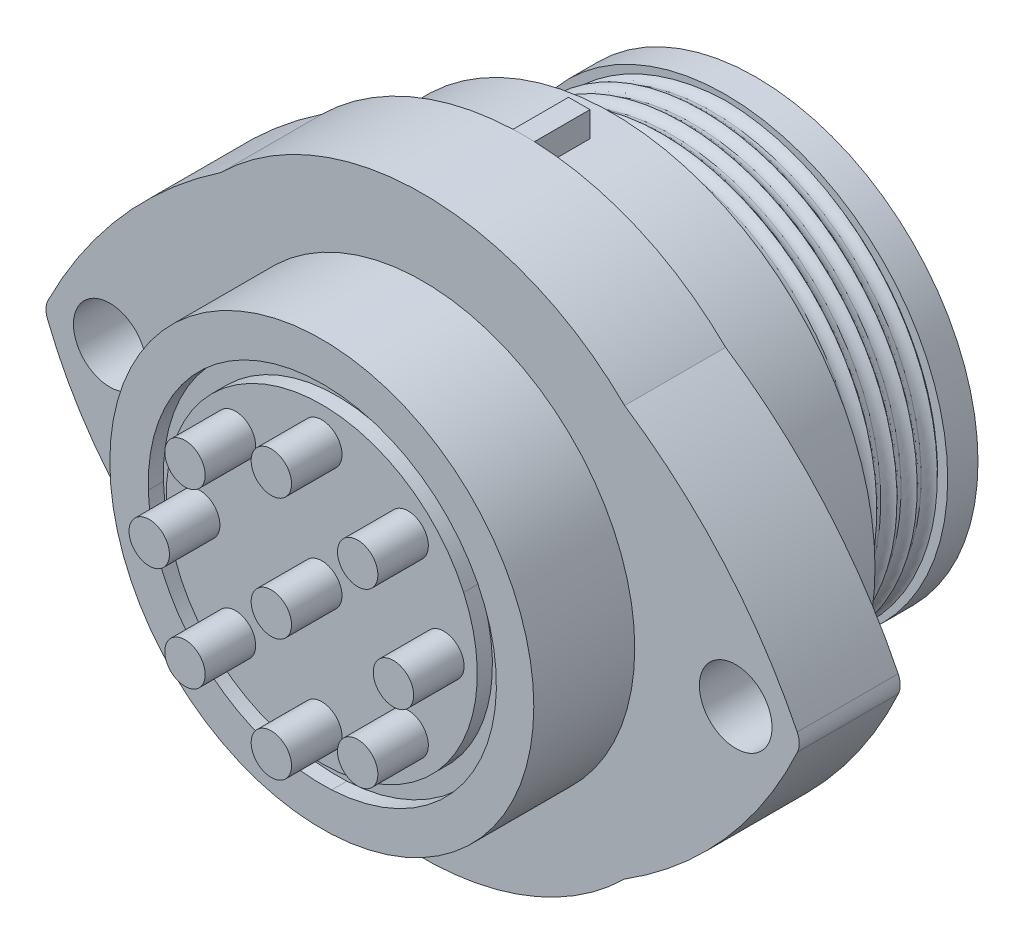
from build123d import *

# Parameters (mm, degrees)
SKETCH1_R            = 10.5
BOSS_EXTRUDE1_DEPTH  = 5
BOSS_EXTRUDE2_DEPTH  = 5
SKETCH3_R            = 1.8
CUT_EXTRUDE1_DEPTH   = 5
FILLET1_R            = 1
SKETCH4_R            = 1
BOSS_EXTRUDE5_DEPTH  = 2.5
SKETCH6_R            = 1
BOSS_EXTRUDE6_DEPTH  = 2.5
CIRPATTERN2_COUNT    = 8
SKETCH7_R            = 13
BOSS_EXTRUDE7_DEPTH  = 4.4
SKETCH8_R            = 11
BOSS_EXTRUDE8_DEPTH  = 5.6
CUT_SWEEP1_PITCH     = 1
CUT_SWEEP1_TO        = 5.6
SKETCH14_R           = 11
BOSS_EXTRUDE9_DEPTH  = 1.5
SKETCH15_R           = 9.5
CUT_EXTRUDE2_DEPTH   = 3.5
SKETCH16_R           = 6.15
BOSS_EXTRUDE10_DEPTH = 5
SKETCH17_R           = 1
CUT_EXTRUDE3_DEPTH   = 3
CIRPATTERN3_COUNT    = 8
SKETCH18_W           = 1.059537874
SKETCH18_H           = 1.27
BOSS_EXTRUDE11_DEPTH = 2.75
CUT_EXTRUDE6_DEPTH   = 0.75


with BuildPart() as part:
    # Sketch1 → Boss-Extrude1 (new body)
    with BuildSketch(Plane.XY):
        Circle(SKETCH1_R)
    extrude(amount=BOSS_EXTRUDE1_DEPTH)

    # Sketch2 → Boss-Extrude2 (add)
    with BuildSketch(Plane.XY):
        with BuildLine():
            ThreePointArc((9.997356942, 10.154573067), (0, 14.25), (-9.997356942, 10.154573067))
            ThreePointArc((-9.997356942, 10.154573067), (-15.049933785, 5.660178727), (-18.75, 0))
            ThreePointArc((-18.75, 0), (-15.295779894, -5.872083573), (-9.997356942, -10.154573067))
            ThreePointArc((-9.997356942, -10.154573067), (0, -14.25), (9.997356942, -10.154573067))
            ThreePointArc((9.997356942, -10.154573067), (15.140826904, -5.738523236), (18.75, 0))
            ThreePointArc((18.75, 0), (15.074492991, 5.681347314), (9.997356942, 10.154573067))
        make_face()
    extrude(amount=-BOSS_EXTRUDE2_DEPTH)

    # Sketch3 → Cut-Extrude1 (cut)
    with BuildSketch(Plane(origin=(0, 0, -5), x_dir=(-1, 0, 0), z_dir=(0, 0, -1))):
        with Locations((-15.5, 0)):
            Circle(SKETCH3_R)
        with Locations((15.5, 0)):
            Circle(SKETCH3_R)
    extrude(amount=-CUT_EXTRUDE1_DEPTH, mode=Mode.SUBTRACT)

    # Fillet1
    fillet1_edges = [part.edges().sort_by_distance(p)[0] for p in [
        (-18.75, 0, -2.5),
        (18.75, 0, -2.5),
    ]]
    fillet(fillet1_edges, radius=FILLET1_R)

    # Sketch4 → Boss-Extrude5 (add)
    with BuildSketch(Plane.XY.offset(5)):
        Circle(SKETCH4_R)
    extrude(amount=BOSS_EXTRUDE5_DEPTH)

    # Sketch6 → Boss-Extrude6 (add)
    with BuildSketch(Plane.XY.offset(5)):
        with Locations((0, 6.047591454)):
            Circle(SKETCH6_R)
    boss_extrude6 = extrude(amount=BOSS_EXTRUDE6_DEPTH)

    # CirPattern2: Boss-Extrude6 ×8 about axis
    cirpattern2_axis = Axis((0, 0, 0), (0, 0, 1))
    for i in range(1, CIRPATTERN2_COUNT):
        add(boss_extrude6.rotate(cirpattern2_axis, i * 360 / CIRPATTERN2_COUNT))

    # Sketch7 → Boss-Extrude7 (add)
    with BuildSketch(Plane(origin=(0, 0, -5), x_dir=(-1, 0, 0), z_dir=(0, 0, -1))):
        with Locations(Location((0, 0, 0), (0, 0, 180))):
            Circle(SKETCH7_R)
    extrude(amount=BOSS_EXTRUDE7_DEPTH)

    # Sketch8 → Boss-Extrude8 (add)
    with BuildSketch(Plane(origin=(0, 0, -9.4), x_dir=(-1, 0, 0), z_dir=(0, 0, -1))):
        Circle(SKETCH8_R)
    extrude(amount=BOSS_EXTRUDE8_DEPTH)

    # Cut-Sweep1: arcs per turn and ends read off the stored shape
    # Cut-Sweep1: the profile of Sketch13 screwed along a left-hand helix through 8 turns, 8 arcs to a turn; built about Z, then put on its axis
    cut_sweep1_z = Axis((0, 0, 0), (0, 0, 1))
    cut_sweep1_corners = [(11, 0, -1.56491125), (10.43508875, 0, -1), (11, 0, -0.43508875), (11.56491125, 0, -1)]
    with BuildLine(mode=Mode.PRIVATE) as cut_sweep1_profile:
        ThreePointArc((11, 0, -1.56491125), (10.600547424, 0, -1.399452576), (10.43508875, 0, -1))
        ThreePointArc((10.43508875, 0, -1), (10.600547424, 0, -0.600547424), (11, 0, -0.43508875))
        ThreePointArc((11, 0, -0.43508875), (11.399452576, 0, -0.600547424), (11.56491125, 0, -1))
        ThreePointArc((11.56491125, 0, -1), (11.399452576, 0, -1.399452576), (11, 0, -1.56491125))
    cut_sweep1_cap = Face(cut_sweep1_profile.wire())
    cut_sweep1_arcs = [((11, 0, -1.56491125), (10.43508875, 0, -1.56491125), (10.43508875, 0, -1), (1, 0.7071067811865476, 1)), ((10.43508875, 0, -1), (10.43508875, 0, -0.43508875), (11, 0, -0.43508875), (1, 0.7071067811865476, 1)), ((11, 0, -0.43508875), (11.56491125, 0, -0.43508875), (11.56491125, 0, -1), (1, 0.7071067811865476, 1)), ((11.56491125, 0, -1), (11.56491125, 0, -1.56491125), (11, 0, -1.56491125), (1, 0.7071067811865476, 1))]  # start, shoulder, end, weights
    cut_sweep1_turn_angles = [0, -22.5, -45, -67.5, -90, -112.5, -135, -157.5, -180, -202.5, -225, -247.5, -270, -292.5, -315, -337.5, -360]
    cut_sweep1_turn_weights = [1, 0.9238795325112867, 1, 0.9238795325112867, 1, 0.9238795325112867, 1, 0.9238795325112867, 1, 0.9238795325112867, 1, 0.9238795325112867, 1, 0.9238795325112867, 1, 0.9238795325112867, 1]
    cut_sweep1_turn_sides = [Face.make_bezier_surface([[Vector(p[j][0], p[j][1], 0).rotate(cut_sweep1_z, cut_sweep1_turn_angles[2 * i + k]) / cut_sweep1_turn_weights[2 * i + k] + Vector(0, 0, p[j][2] + -CUT_SWEEP1_PITCH * cut_sweep1_turn_angles[2 * i + k] / 360) for k in range(3)] for j in range(3)], [[p[3][j] * cut_sweep1_turn_weights[2 * i + k] for k in range(3)] for j in range(3)]) for p in cut_sweep1_arcs for i in range(8)]
    cut_sweep1_turn = Solid(Shell([*cut_sweep1_turn_sides, cut_sweep1_cap, cut_sweep1_cap.rotate(cut_sweep1_z, -360).moved(Location((0, 0, -CUT_SWEEP1_PITCH * -360 / 360)))]))
    cut_sweep1_each = [*[cut_sweep1_turn.moved(Location((0, 0, CUT_SWEEP1_PITCH * i))) for i in range(8)]]
    add(Plane(origin=(0, 0, -15), x_dir=(0, -1, 0), z_dir=(0, 0, 1)) * split(Compound([cut_sweep1_each[i] for i in range(0, 8, 2)]), bisect_by=Plane.XY.offset(CUT_SWEEP1_TO), keep=Keep.BOTTOM, mode=Mode.PRIVATE), mode=Mode.SUBTRACT)
    add(Plane(origin=(0, 0, -15), x_dir=(0, -1, 0), z_dir=(0, 0, 1)) * split(Compound([cut_sweep1_each[i] for i in range(1, 8, 2)]), bisect_by=Plane.XY.offset(CUT_SWEEP1_TO), keep=Keep.BOTTOM, mode=Mode.PRIVATE), mode=Mode.SUBTRACT)

    # Sketch14 → Boss-Extrude9 (add)
    with BuildSketch(Plane(origin=(0, 0, -15), x_dir=(-1, 0, 0), z_dir=(0, 0, -1))):
        Circle(SKETCH14_R)
    extrude(amount=BOSS_EXTRUDE9_DEPTH)

    # Sketch15 → Cut-Extrude2 (cut)
    with BuildSketch(Plane(origin=(0, 0, -16.5), x_dir=(-1, 0, 0), z_dir=(0, 0, -1))):
        Circle(SKETCH15_R)
    extrude(amount=-CUT_EXTRUDE2_DEPTH, mode=Mode.SUBTRACT)

    # Sketch16 → Boss-Extrude10 (add)
    with BuildSketch(Plane(origin=(0, 0, -13), x_dir=(-1, 0, 0), z_dir=(0, 0, -1))):
        Circle(SKETCH16_R)
    extrude(amount=BOSS_EXTRUDE10_DEPTH)

    # Sketch17 → Cut-Extrude3 (cut)
    with BuildSketch(Plane(origin=(0, 0, -18), x_dir=(-1, 0, 0), z_dir=(0, 0, -1))):
        with Locations(Location((0, 0, 0), (0, 0, 180))):
            Circle(SKETCH17_R)
        with Locations((0, 3.43)):
            Circle(SKETCH17_R)
    cut_extrude3 = extrude(amount=-CUT_EXTRUDE3_DEPTH, mode=Mode.SUBTRACT)

    # CirPattern3: Cut-Extrude3 ×8 about axis
    cirpattern3_axis = Axis((0, 0, 0), (0, 0, 1))
    for i in range(1, CIRPATTERN3_COUNT):
        add(cut_extrude3.rotate(cirpattern3_axis, i * 360 / CIRPATTERN3_COUNT), mode=Mode.SUBTRACT)

    # Sketch18 → Boss-Extrude11 (add)
    with BuildSketch(Plane(origin=(0, 0, -5), x_dir=(-1, 0, 0), z_dir=(0, 0, -1))):
        with Locations((0, 13.605149047)):
            Rectangle(SKETCH18_W, SKETCH18_H)
    extrude(amount=BOSS_EXTRUDE11_DEPTH)

    # Sketch24 → Cut-Extrude6 (cut)
    with BuildSketch(Plane.XY.offset(5)):
        with BuildLine():
            ThreePointArc((-0.74642073, 8.567546679), (-6.428977344, 5.712114347), (-8.595854871, -0.266981341))
            ThreePointArc((-8.595854871, -0.266981341), (-5.807807312, -6.340999235), (0.487735916, -8.584442577))
            ThreePointArc((0.487735916, -8.584442577), (6.362076156, -5.834326565), (8.644619051, 0.237000247))
            ThreePointArc((8.644619051, 0.237000247), (5.75477121, 6.43781077), (-0.74642073, 8.567546679))
        make_face()
        with BuildLine():
            ThreePointArc((-7.696291446, -0.238951817), (-7.49612092, -1.760162251), (-6.998311859, -3.211484256))
            ThreePointArc((-6.998311859, -3.211484256), (-0.779335334, -7.660459284), (6.208185548, -4.555044699))
            ThreePointArc((6.208185548, -4.555044699), (7.657579625, -0.81073458), (7.025043628, 3.154173952))
            ThreePointArc((7.025043628, 3.154173952), (-1.729484835, 7.504983058), (-7.696291446, -0.238951817))
        make_face(mode=Mode.SUBTRACT)
    extrude(amount=-CUT_EXTRUDE6_DEPTH, mode=Mode.SUBTRACT)


solid = part.part
